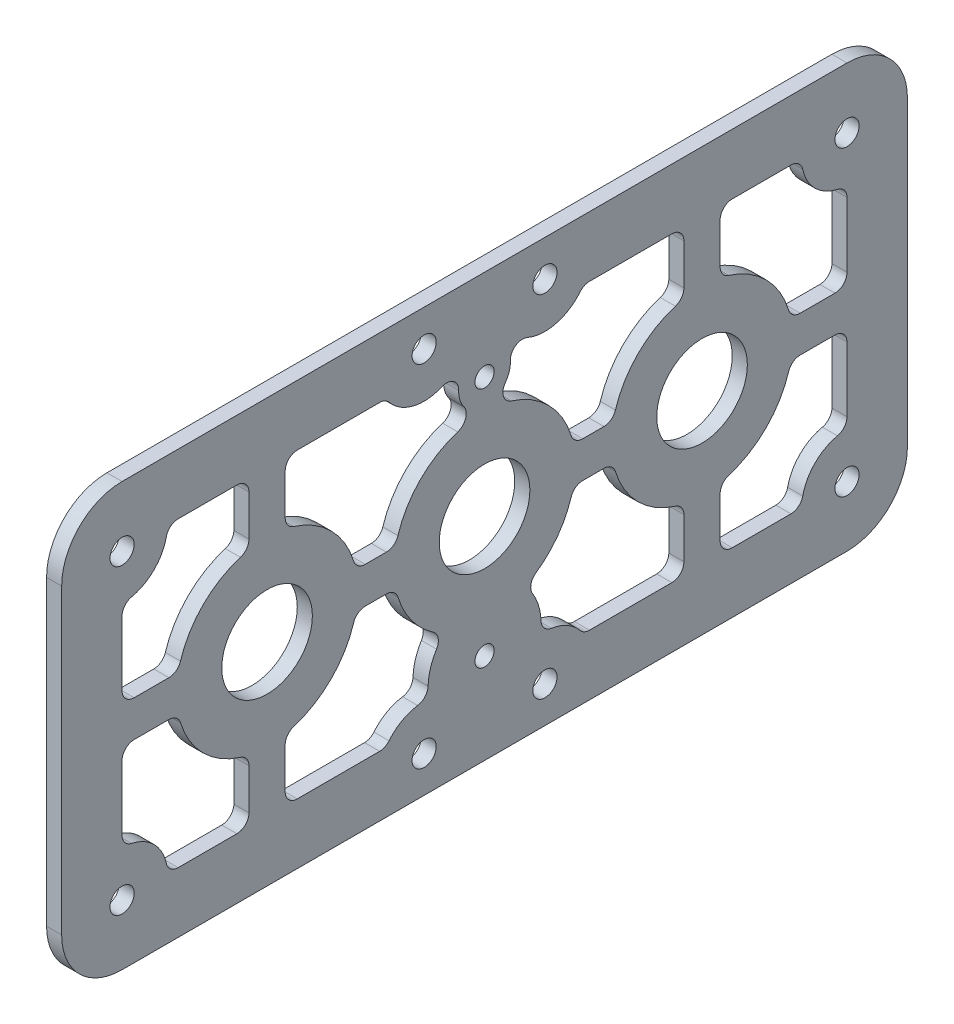
from build123d import *

# Parameters (mm, degrees)
SKETCH1_R           = 2.54
SKETCH1_R_2         = 2.0193
SKETCH1_R_3         = 9.525
BOSS_EXTRUDE1_DEPTH = 3.175
CUT_EXTRUDE1_DEPTH  = 3.175


with BuildPart() as part:
    # Sketch1 → Boss-Extrude1 (new body)
    with BuildSketch(Plane(origin=(0, 0, 0), x_dir=(0, 0, -1), z_dir=(1, 0, 0))):
        with BuildLine():
            Line((226.734866781, 43.274288567), (226.734866781, 106.774288567))
            ThreePointArc((226.734866781, 106.774288567), (230.45461066, 115.754544688), (239.434866781, 119.474288567))
            Line((239.434866781, 119.474288567), (391.834866781, 119.474288567))
            ThreePointArc((391.834866781, 119.474288567), (400.815122902, 115.754544688), (404.534866781, 106.774288567))
            Line((404.534866781, 106.774288567), (404.534866781, 43.274288567))
            ThreePointArc((404.534866781, 43.274288567), (400.815122902, 34.294032445), (391.834866781, 30.574288567))
            Line((391.834866781, 30.574288567), (239.434866781, 30.574288567))
            ThreePointArc((239.434866781, 30.574288567), (230.45461066, 34.294032445), (226.734866781, 43.274288567))
        make_face()
        with Locations((302.934866781, 111.854288567)):
            Circle(SKETCH1_R, mode=Mode.SUBTRACT)
        with Locations((328.334866781, 111.854288567)):
            Circle(SKETCH1_R, mode=Mode.SUBTRACT)
        with Locations((315.634866781, 100.424288567)):
            Circle(SKETCH1_R_2, mode=Mode.SUBTRACT)
        with Locations((302.934866781, 38.194288567)):
            Circle(SKETCH1_R, mode=Mode.SUBTRACT)
        with Locations((328.334866781, 38.194288567)):
            Circle(SKETCH1_R, mode=Mode.SUBTRACT)
        with Locations((239.434866781, 43.274288567)):
            Circle(SKETCH1_R, mode=Mode.SUBTRACT)
        with Locations((391.834866781, 43.274288567)):
            Circle(SKETCH1_R, mode=Mode.SUBTRACT)
        with Locations((315.634866781, 75.024288567)):
            Circle(SKETCH1_R_3, mode=Mode.SUBTRACT)
        with Locations((315.634866781, 49.624288567)):
            Circle(SKETCH1_R_2, mode=Mode.SUBTRACT)
        with Locations((239.434866781, 106.774288567)):
            Circle(SKETCH1_R, mode=Mode.SUBTRACT)
        with Locations((391.834866781, 106.774288567)):
            Circle(SKETCH1_R, mode=Mode.SUBTRACT)
        with Locations((269.914866781, 75.024288567)):
            Circle(SKETCH1_R_3, mode=Mode.SUBTRACT)
        with Locations((361.354866781, 75.024288567)):
            Circle(SKETCH1_R_3, mode=Mode.SUBTRACT)
    extrude(amount=BOSS_EXTRUDE1_DEPTH)

    # Sketch2 → Cut-Extrude1 (cut)
    with BuildSketch(Plane(origin=(3.175, 0, 0), x_dir=(0, 0, -1), z_dir=(1, 0, 0))):
        with BuildLine():
            Line((239.434866781, 68.674288567), (239.434866781, 55.068890086))
            ThreePointArc((239.434866781, 55.068890086), (239.998780804, 53.473056695), (241.440129939, 52.585816082))
            ThreePointArc((241.440129939, 52.585816082), (246.170058872, 50.009480657), (248.746394297, 45.279551724))
            ThreePointArc((248.746394297, 45.279551724), (249.63363491, 43.838202589), (251.229468301, 43.274288567))
            Line((251.229468301, 43.274288567), (263.564866781, 43.274288567))
            ThreePointArc((263.564866781, 43.274288567), (265.360918005, 44.018237342), (266.104866781, 45.814288567))
            Line((266.104866781, 45.814288567), (266.104866781, 54.389231019))
            ThreePointArc((266.104866781, 54.389231019), (265.608041934, 55.898215874), (264.311925605, 56.816884848))
            ThreePointArc((264.311925605, 56.816884848), (256.4444826, 61.553904385), (251.707463063, 69.42134739))
            ThreePointArc((251.707463063, 69.42134739), (250.788794089, 70.71746372), (249.279809233, 71.214288567))
            Line((249.279809233, 71.214288567), (241.974866781, 71.214288567))
            ThreePointArc((241.974866781, 71.214288567), (240.178815557, 70.470339791), (239.434866781, 68.674288567))
        make_face()
        with BuildLine():
            Line((266.104866781, 104.234288567), (266.104866781, 95.659346114))
            ThreePointArc((266.104866781, 95.659346114), (265.608041934, 94.150361259), (264.311925605, 93.231692285))
            ThreePointArc((264.311925605, 93.231692285), (256.4444826, 88.494672748), (251.707463063, 80.627229743))
            ThreePointArc((251.707463063, 80.627229743), (250.788794089, 79.331113414), (249.279809233, 78.834288567))
            Line((249.279809233, 78.834288567), (241.974866781, 78.834288567))
            ThreePointArc((241.974866781, 78.834288567), (240.178815557, 79.578237342), (239.434866781, 81.374288567))
            Line((239.434866781, 81.374288567), (239.434866781, 94.979687047))
            ThreePointArc((239.434866781, 94.979687047), (239.998780804, 96.575520438), (241.440129939, 97.462761051))
            ThreePointArc((241.440129939, 97.462761051), (246.170058872, 100.039096476), (248.746394297, 104.769025409))
            ThreePointArc((248.746394297, 104.769025409), (249.63363491, 106.210374544), (251.229468301, 106.774288567))
            Line((251.229468301, 106.774288567), (263.564866781, 106.774288567))
            ThreePointArc((263.564866781, 106.774288567), (265.360918005, 106.030339791), (266.104866781, 104.234288567))
        make_face()
        with BuildLine():
            Line((273.724866781, 104.234288567), (273.724866781, 95.659346114))
            ThreePointArc((273.724866781, 95.659346114), (274.221691628, 94.150361259), (275.517807958, 93.231692285))
            ThreePointArc((275.517807958, 93.231692285), (283.385250963, 88.494672748), (288.1222705, 80.627229743))
            ThreePointArc((288.1222705, 80.627229743), (289.040939474, 79.331113414), (290.549924329, 78.834288567))
            Line((290.549924329, 78.834288567), (294.999809233, 78.834288567))
            ThreePointArc((294.999809233, 78.834288567), (296.508794089, 79.331113414), (297.427463063, 80.627229743))
            ThreePointArc((297.427463063, 80.627229743), (302.151982675, 88.482161213), (309.998128243, 93.221257508))
            ThreePointArc((309.998128243, 93.221257508), (311.662231798, 94.862571144), (311.280770987, 97.168571739))
            ThreePointArc((311.280770987, 97.168571739), (310.441422988, 98.816189123), (310.202834456, 100.649825844))
            ThreePointArc((310.202834456, 100.649825844), (309.109078091, 102.844764639), (306.669199045, 103.091846695))
            ThreePointArc((306.669199045, 103.091846695), (300.650664186, 102.60723263), (295.550024061, 105.838499093))
            ThreePointArc((295.550024061, 105.838499093), (294.670894414, 106.528443611), (293.580732668, 106.774288567))
            Line((293.580732668, 106.774288567), (276.264866781, 106.774288567))
            ThreePointArc((276.264866781, 106.774288567), (274.468815557, 106.030339791), (273.724866781, 104.234288567))
        make_face()
        with BuildLine():
            Line((391.834866781, 55.068890086), (391.834866781, 68.674288567))
            ThreePointArc((391.834866781, 68.674288567), (391.090918005, 70.470339791), (389.294866781, 71.214288567))
            Line((389.294866781, 71.214288567), (381.989924329, 71.214288567))
            ThreePointArc((381.989924329, 71.214288567), (380.480939474, 70.71746372), (379.5622705, 69.42134739))
            ThreePointArc((379.5622705, 69.42134739), (374.825250963, 61.553904385), (366.957807958, 56.816884848))
            ThreePointArc((366.957807958, 56.816884848), (365.661691628, 55.898215874), (365.164866781, 54.389231019))
            Line((365.164866781, 54.389231019), (365.164866781, 45.814288567))
            ThreePointArc((365.164866781, 45.814288567), (365.908815557, 44.018237342), (367.704866781, 43.274288567))
            Line((367.704866781, 43.274288567), (380.040265262, 43.274288567))
            ThreePointArc((380.040265262, 43.274288567), (381.636098653, 43.838202589), (382.523339266, 45.279551724))
            ThreePointArc((382.523339266, 45.279551724), (385.09967469, 50.009480657), (389.829603623, 52.585816082))
            ThreePointArc((389.829603623, 52.585816082), (391.270952759, 53.473056695), (391.834866781, 55.068890086))
        make_face()
        with BuildLine():
            Line((380.040265262, 106.774288567), (367.704866781, 106.774288567))
            ThreePointArc((367.704866781, 106.774288567), (365.908815557, 106.030339791), (365.164866781, 104.234288567))
            Line((365.164866781, 104.234288567), (365.164866781, 95.659346114))
            ThreePointArc((365.164866781, 95.659346114), (365.661691628, 94.150361259), (366.957807958, 93.231692285))
            ThreePointArc((366.957807958, 93.231692285), (374.825250963, 88.494672748), (379.5622705, 80.627229743))
            ThreePointArc((379.5622705, 80.627229743), (380.480939474, 79.331113414), (381.989924329, 78.834288567))
            Line((381.989924329, 78.834288567), (389.294866781, 78.834288567))
            ThreePointArc((389.294866781, 78.834288567), (391.090918005, 79.578237342), (391.834866781, 81.374288567))
            Line((391.834866781, 81.374288567), (391.834866781, 94.979687047))
            ThreePointArc((391.834866781, 94.979687047), (391.270952759, 96.575520438), (389.829603623, 97.462761051))
            ThreePointArc((389.829603623, 97.462761051), (385.09967469, 100.039096476), (382.523339266, 104.769025409))
            ThreePointArc((382.523339266, 104.769025409), (381.636098653, 106.210374544), (380.040265262, 106.774288567))
        make_face()
        with BuildLine():
            Line((290.549924329, 71.214288567), (294.999809233, 71.214288567))
            ThreePointArc((294.999809233, 71.214288567), (296.508794089, 70.71746372), (297.427463063, 69.42134739))
            ThreePointArc((297.427463063, 69.42134739), (300.276066698, 63.754427875), (304.827226221, 59.336796558))
            ThreePointArc((304.827226221, 59.336796558), (305.872771589, 57.763396268), (305.542854345, 55.90331342))
            ThreePointArc((305.542854345, 55.90331342), (304.266005839, 53.091833663), (303.756451389, 50.04632635))
            ThreePointArc((303.756451389, 50.04632635), (303.107803882, 48.439328682), (301.579487542, 47.622362183))
            ThreePointArc((301.579487542, 47.622362183), (298.243514019, 46.483850332), (295.550024061, 44.21007804))
            ThreePointArc((295.550024061, 44.21007804), (294.670894414, 43.520133522), (293.580732668, 43.274288567))
            Line((293.580732668, 43.274288567), (276.264866781, 43.274288567))
            ThreePointArc((276.264866781, 43.274288567), (274.468815557, 44.018237342), (273.724866781, 45.814288567))
            Line((273.724866781, 45.814288567), (273.724866781, 54.389231019))
            ThreePointArc((273.724866781, 54.389231019), (274.221691628, 55.898215874), (275.517807958, 56.816884848))
            ThreePointArc((275.517807958, 56.816884848), (283.385250963, 61.553904385), (288.1222705, 69.42134739))
            ThreePointArc((288.1222705, 69.42134739), (289.040939474, 70.71746372), (290.549924329, 71.214288567))
        make_face()
        with BuildLine():
            Line((336.269924329, 78.834288567), (340.719809233, 78.834288567))
            ThreePointArc((340.719809233, 78.834288567), (342.228794089, 79.331113414), (343.147463063, 80.627229743))
            ThreePointArc((343.147463063, 80.627229743), (347.8844826, 88.494672748), (355.751925605, 93.231692285))
            ThreePointArc((355.751925605, 93.231692285), (357.048041934, 94.150361259), (357.544866781, 95.659346114))
            Line((357.544866781, 95.659346114), (357.544866781, 104.234288567))
            ThreePointArc((357.544866781, 104.234288567), (356.800918005, 106.030339791), (355.004866781, 106.774288567))
            Line((355.004866781, 106.774288567), (337.689000894, 106.774288567))
            ThreePointArc((337.689000894, 106.774288567), (336.598839148, 106.528443611), (335.719709502, 105.838499093))
            ThreePointArc((335.719709502, 105.838499093), (330.619069377, 102.60723263), (324.600534518, 103.091846695))
            ThreePointArc((324.600534518, 103.091846695), (322.160655472, 102.844764639), (321.066899107, 100.649825844))
            ThreePointArc((321.066899107, 100.649825844), (320.828310574, 98.816189123), (319.988962576, 97.168571739))
            ThreePointArc((319.988962576, 97.168571739), (319.607501764, 94.862571144), (321.27160532, 93.221257508))
            ThreePointArc((321.27160532, 93.221257508), (329.117750888, 88.482161213), (333.8422705, 80.627229743))
            ThreePointArc((333.8422705, 80.627229743), (334.760939474, 79.331113414), (336.269924329, 78.834288567))
        make_face()
        with BuildLine():
            Line((336.269924329, 71.214288567), (340.719809233, 71.214288567))
            ThreePointArc((340.719809233, 71.214288567), (342.228794089, 70.71746372), (343.147463063, 69.42134739))
            ThreePointArc((343.147463063, 69.42134739), (347.8844826, 61.553904385), (355.751925605, 56.816884848))
            ThreePointArc((355.751925605, 56.816884848), (357.048041934, 55.898215874), (357.544866781, 54.389231019))
            Line((357.544866781, 54.389231019), (357.544866781, 45.814288567))
            ThreePointArc((357.544866781, 45.814288567), (356.800918005, 44.018237342), (355.004866781, 43.274288567))
            Line((355.004866781, 43.274288567), (337.689000894, 43.274288567))
            ThreePointArc((337.689000894, 43.274288567), (336.598839148, 43.520133522), (335.719709502, 44.21007804))
            ThreePointArc((335.719709502, 44.21007804), (333.026219544, 46.483850332), (329.69024602, 47.622362183))
            ThreePointArc((329.69024602, 47.622362183), (328.16192968, 48.439328682), (327.513282174, 50.04632635))
            ThreePointArc((327.513282174, 50.04632635), (327.003727724, 53.091833663), (325.726879218, 55.90331342))
            ThreePointArc((325.726879218, 55.90331342), (325.396961974, 57.763396268), (326.442507341, 59.336796558))
            ThreePointArc((326.442507341, 59.336796558), (330.993666864, 63.754427875), (333.8422705, 69.42134739))
            ThreePointArc((333.8422705, 69.42134739), (334.760939474, 70.71746372), (336.269924329, 71.214288567))
        make_face()
    extrude(amount=-CUT_EXTRUDE1_DEPTH, mode=Mode.SUBTRACT)


solid = part.part
